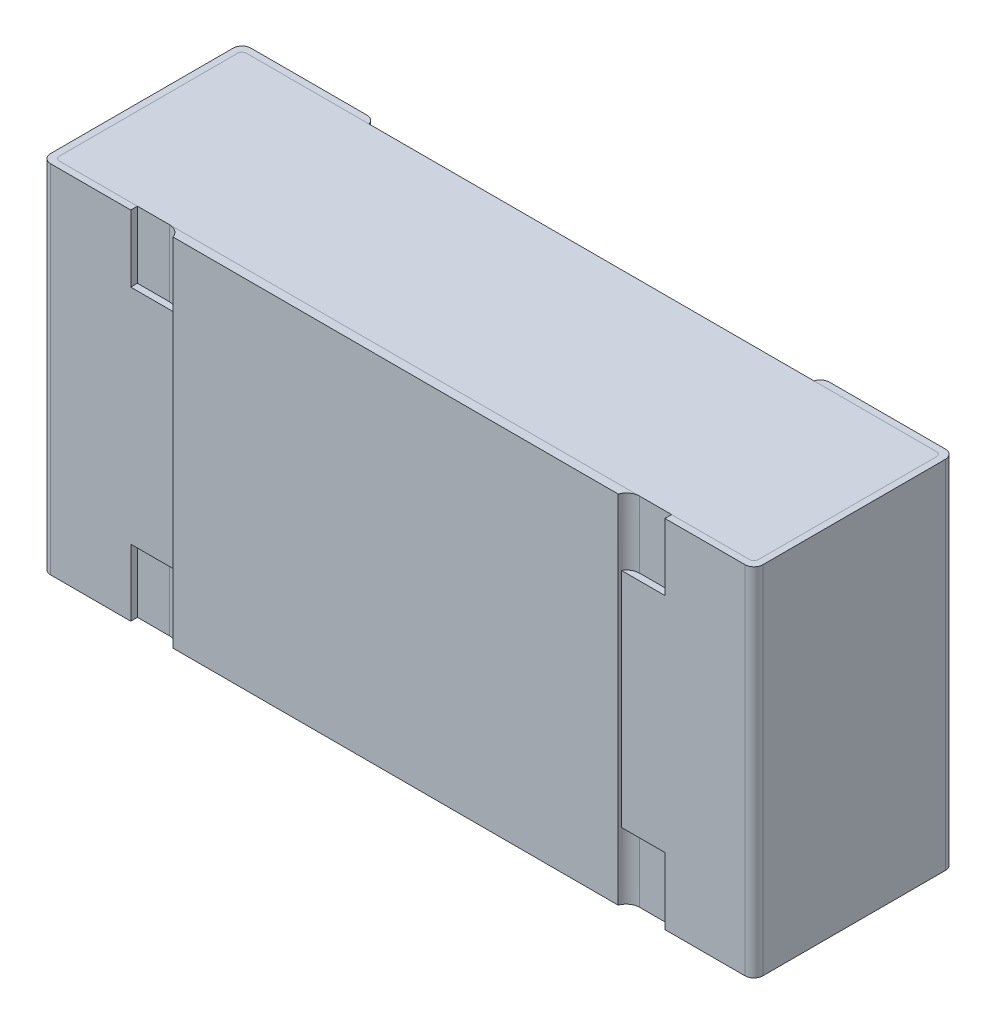
from build123d import *

# Parameters (mm, degrees)
SKETCH1_W                        = 1.6
SKETCH1_H                        = 0.8
ALL_BODY_EXTRUDE_DEPTH           = 0.45
SKETCH3_W                        = 1.2
SKETCH3_H                        = 0.15
CUT_OUT_FOR_PIN_UPPER_DEPTH      = 0.015
SKETCH2_W                        = 1
SKETCH2_H                        = 0.8
CUT_OUT_FOR_PIN_LOWER_DEPTH      = 0.015
SKETCH4_W                        = 1
SKETCH4_H                        = 0.8
COATING_EXTRUDE_DEPTH            = 0.02
COATING_START                    = -0.4
COATING_FILLET_DEPTH             = 0.8
BODY_CUT_OUT_FOR_TOTAL_PIN_DEPTH = 2.219436345
BODY_EXTRUDE_DEPTH               = 0.8
PIN_FILLET_R                     = 0.02


with BuildPart() as part:
    # Sketch1 → All body extrude (new body)
    with BuildSketch(Plane.XY):
        Rectangle(SKETCH1_W, SKETCH1_H)
    extrude(amount=ALL_BODY_EXTRUDE_DEPTH)

    # Sketch3 → Cut out for pin-upper (cut)
    with BuildSketch(Plane.XY.offset(0.45)):
        with Locations((0, 0.325)):
            Rectangle(SKETCH3_W, SKETCH3_H)
        with Locations((0, -0.325)):
            Rectangle(SKETCH3_W, SKETCH3_H)
    extrude(amount=-CUT_OUT_FOR_PIN_UPPER_DEPTH, mode=Mode.SUBTRACT)

    # Sketch2 → Cut out for pin-lower (cut)
    with BuildSketch(Plane(origin=(0, 0, 0), x_dir=(-1, 0, 0), z_dir=(0, 0, -1))):
        Rectangle(SKETCH2_W, SKETCH2_H)
    extrude(amount=-CUT_OUT_FOR_PIN_LOWER_DEPTH, mode=Mode.SUBTRACT)

    # Sketch4 → Coating extrude (add)
    with BuildSketch(Plane.XY.offset(0.435)):
        Rectangle(SKETCH4_W, SKETCH4_H)
    extrude(amount=COATING_EXTRUDE_DEPTH)

    # Coating fillet: read off the stored shape, not the designer's step
    # Coating fillet outline → Coating fillet (add)
    with BuildSketch(Plane(origin=(0, 0, 0), x_dir=(1, 0, 0), z_dir=(0, 1, 0)).offset(COATING_START)):
        with BuildLine():
            Line((-0.5, -0.435), (-0.528284271, -0.435))
            ThreePointArc((-0.528284271, -0.435), (-0.510963763, -0.440505103), (-0.5, -0.455))
            Line((-0.5, -0.455), (-0.5, -0.435))
        make_face()
        with BuildLine():
            ThreePointArc((0.5, -0.455), (0.510963763, -0.440505103), (0.528284271, -0.435))
            Line((0.528284271, -0.435), (0.5, -0.435))
            Line((0.5, -0.435), (0.5, -0.455))
        make_face()
    extrude(amount=COATING_FILLET_DEPTH)

    # Sketch6 → Body cut out for total pin (cut, through all)
    with BuildSketch(Plane.XZ.offset(0.4)):
        with BuildLine():
            Line((-0.775, 0.435), (0.775, 0.435))
            ThreePointArc((0.775, 0.435), (0.782071068, 0.432071068), (0.785, 0.425))
            Line((0.785, 0.425), (0.785, 0.025))
            ThreePointArc((0.785, 0.025), (0.782071068, 0.017928932), (0.775, 0.015))
            Line((0.775, 0.015), (-0.775, 0.015))
            ThreePointArc((-0.775, 0.015), (-0.782071068, 0.017928932), (-0.785, 0.025))
            Line((-0.785, 0.025), (-0.785, 0.425))
            ThreePointArc((-0.785, 0.425), (-0.782071068, 0.432071068), (-0.775, 0.435))
        make_face()
    extrude(amount=-BODY_CUT_OUT_FOR_TOTAL_PIN_DEPTH, mode=Mode.SUBTRACT)

    # Pin fillet
    # the kernel refuses this fillet: 0.02 mm, written as the material it takes off along each edge
    with BuildSketch(Plane(origin=(0.8, 0.45, 0.45), x_dir=(-1, 0, 0), z_dir=(0, -1, 0)), Plane(origin=(-0.8, -0.45, 0.45), x_dir=(1, 0, 0), z_dir=(0, 1, 0))) as pin_fillet_piece_1:
        with BuildLine():
            CenterArc((PIN_FILLET_R, PIN_FILLET_R), PIN_FILLET_R, 180, 90)
            Line((0, PIN_FILLET_R), (-PIN_FILLET_R * 0.02, PIN_FILLET_R))
            Line((-PIN_FILLET_R * 0.02, PIN_FILLET_R), (-PIN_FILLET_R * 0.02, -PIN_FILLET_R * 0.02))
            Line((-PIN_FILLET_R * 0.02, -PIN_FILLET_R * 0.02), (PIN_FILLET_R, -PIN_FILLET_R * 0.02))
            Line((PIN_FILLET_R, -PIN_FILLET_R * 0.02), (PIN_FILLET_R, 0))
        make_face()
    extrude(amount=0.9, mode=Mode.SUBTRACT)
    with BuildSketch(Plane(origin=(0.8, 0.45, 0), x_dir=(-1, 0, 0), z_dir=(0, -1, 0)), Plane(origin=(-0.8, -0.45, 0), x_dir=(1, 0, 0), z_dir=(0, 1, 0))) as pin_fillet_piece_2:
        with BuildLine():
            CenterArc((PIN_FILLET_R, -PIN_FILLET_R), PIN_FILLET_R, 90, 90)
            Line((0, -PIN_FILLET_R), (-PIN_FILLET_R * 0.02, -PIN_FILLET_R))
            Line((-PIN_FILLET_R * 0.02, -PIN_FILLET_R), (-PIN_FILLET_R * 0.02, PIN_FILLET_R * 0.02))
            Line((-PIN_FILLET_R * 0.02, PIN_FILLET_R * 0.02), (PIN_FILLET_R, PIN_FILLET_R * 0.02))
            Line((PIN_FILLET_R, PIN_FILLET_R * 0.02), (PIN_FILLET_R, 0))
        make_face()
    extrude(amount=0.9, mode=Mode.SUBTRACT)
    with BuildSketch(Plane(origin=(0.5, -0.448412292, 0), x_dir=(1, 0, 0), z_dir=(0, 1, 0)), Plane(origin=(-0.5, 0.448412292, 0), x_dir=(-1, 0, 0), z_dir=(0, -1, 0))) as pin_fillet_piece_3:
        with BuildLine():
            CenterArc((0.019364917, -0.02), PIN_FILLET_R, 90, 75.522487815)
            Line((0, -0.015), (-0.000387298, -0.0149))
            ThreePointArc((-0.000387298, -0.0149), (-0.0004, -0.0075), (-0.0004, 0))
            Line((-0.0004, 0), (0, 0.0004))
            Line((0, 0.0004), (0.019364917, 0.0004))
            Line((0.019364917, 0.0004), (0.019364917, 0))
        make_face()
    extrude(amount=0.896824584, mode=Mode.SUBTRACT)


with BuildPart() as body_2:
    # Sketch7 → Body extrude (new, through all)
    with BuildSketch(Plane(origin=(0, -0.4, 0), x_dir=(1, 0, 0), z_dir=(0, 1, 0))):
        with BuildLine():
            Line((-0.775, -0.435), (0.775, -0.435))
            ThreePointArc((0.775, -0.435), (0.782071068, -0.432071068), (0.785, -0.425))
            Line((0.785, -0.425), (0.785, -0.025))
            ThreePointArc((0.785, -0.025), (0.782071068, -0.017928932), (0.775, -0.015))
            Line((0.775, -0.015), (-0.775, -0.015))
            ThreePointArc((-0.775, -0.015), (-0.782071068, -0.017928932), (-0.785, -0.025))
            Line((-0.785, -0.025), (-0.785, -0.425))
            ThreePointArc((-0.785, -0.425), (-0.782071068, -0.432071068), (-0.775, -0.435))
        make_face()
    extrude(amount=BODY_EXTRUDE_DEPTH)


solid = Compound([part.part, body_2.part])
